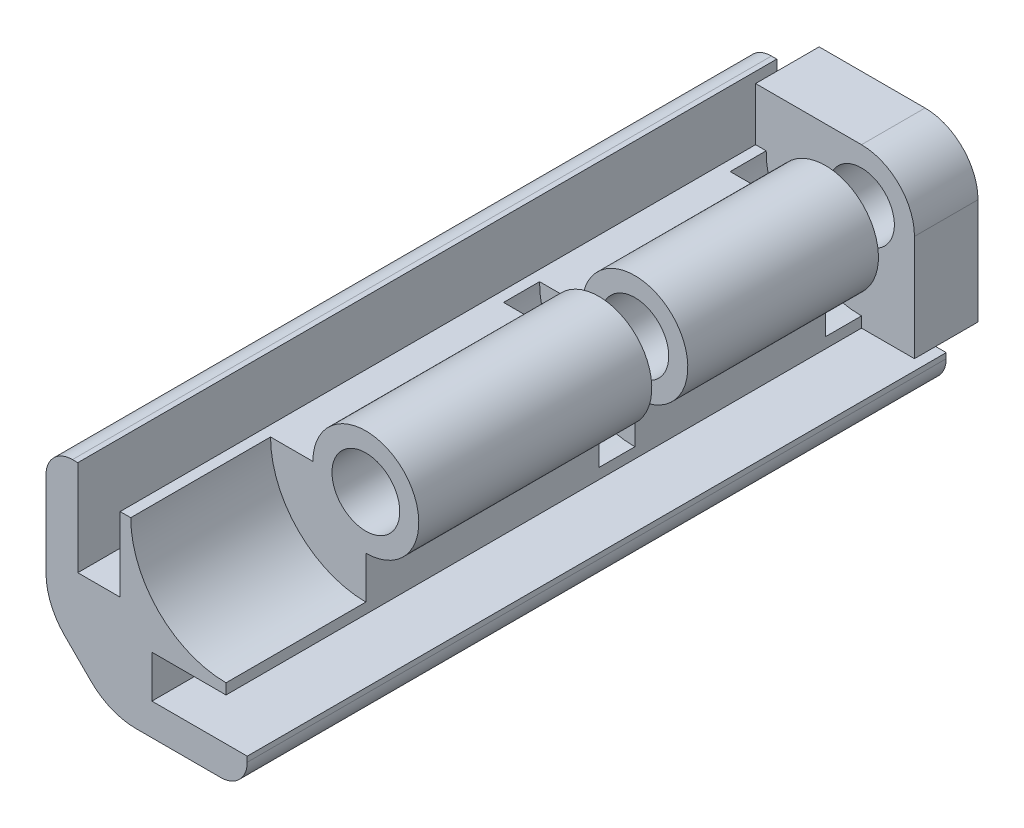
from build123d import *

# Parameters (mm, degrees)
SKETCH1_R              = 1.55
BOSS_EXTRUDE1_DEPTH    = 33
CUT_EXTRUDE2_START     = 3
CUT_EXTRUDE2_OUTLINE_R = 1.55
CUT_EXTRUDE2_DEPTH     = 30
BOSS_EXTRUDE3_START    = 15.4
SKETCH7_R              = 1.6
BOSS_EXTRUDE3_DEPTH    = 11
SKETCH14_R             = 1.6
BOSS_EXTRUDE4_DEPTH    = 9


# Read off the part's stored shape, not the designer's step: Cut-Extrude2
with BuildPart() as part:
    # Sketch1 → Boss-Extrude1 (new body)
    with BuildSketch(Plane.XY):
        with BuildLine():
            Line((9.5, 1.5), (9.5, 1.25))
            ThreePointArc((9.5, 1.25), (9.133883476, 0.366116524), (8.25, 0))
            Line((8.25, 0), (4.242640687, 0))
            ThreePointArc((4.242640687, 0), (3.09459039, 0.228361402), (2.121320344, 0.878679656))
            Line((2.121320344, 0.878679656), (0.878679656, 2.121320344))
            ThreePointArc((0.878679656, 2.121320344), (0.228361402, 3.09459039), (0, 4.242640687))
            Line((0, 4.242640687), (0, 8.25))
            ThreePointArc((0, 8.25), (0.366116524, 9.133883476), (1.25, 9.5))
            Line((1.25, 9.5), (1.5, 9.5))
            Line((1.5, 9.5), (1.5, 5))
            Line((1.5, 5), (3.5, 5))
            Line((3.5, 5), (3.5, 11))
            Line((3.5, 11), (8.5, 11))
            ThreePointArc((8.5, 11), (10.267766953, 10.267766953), (11, 8.5))
            Line((11, 8.5), (11, 3.5))
            Line((11, 3.5), (5, 3.5))
            Line((5, 3.5), (5, 1.5))
            Line((5, 1.5), (9.5, 1.5))
        make_face()
        with Locations((8.5, 8.5)):
            Circle(SKETCH1_R, mode=Mode.SUBTRACT)
    extrude(amount=BOSS_EXTRUDE1_DEPTH)

    # Cut-Extrude2 outline → Cut-Extrude2 (cut)
    with BuildSketch(Plane.XY.offset(CUT_EXTRUDE2_START)):
        with BuildLine():
            Line((3.5, 8.5), (4, 8.5))
            ThreePointArc((4, 8.5), (5.318019485, 5.318019485), (8.5, 4))
            Line((8.5, 4), (8.5, 3.5))
            Line((8.5, 3.5), (11, 3.5))
            Line((11, 3.5), (11, 8.5))
            ThreePointArc((11, 8.5), (10.267766953, 10.267766953), (8.5, 11))
            Line((8.5, 11), (3.5, 11))
            Line((3.5, 11), (3.5, 8.5))
        make_face()
        with Locations((8.5, 8.5)):
            Circle(CUT_EXTRUDE2_OUTLINE_R, mode=Mode.SUBTRACT)
    extrude(amount=CUT_EXTRUDE2_DEPTH, mode=Mode.SUBTRACT)

    # Sketch7 → Boss-Extrude3 (add)
    with BuildSketch(Plane.XY.offset(BOSS_EXTRUDE3_START)):
        with BuildLine():
            Line((8.5, 6), (8.5, 4))
            ThreePointArc((8.5, 4), (5.318019485, 5.318019485), (4, 8.5))
            Line((4, 8.5), (6, 8.5))
            ThreePointArc((6, 8.5), (10.267766953, 10.267766953), (8.5, 6))
        make_face()
        with Locations((8.5, 8.5)):
            Circle(SKETCH7_R, mode=Mode.SUBTRACT)
    extrude(amount=BOSS_EXTRUDE3_DEPTH)

    # Sketch14 → Boss-Extrude4 (add)
    with BuildSketch(Plane.XY.offset(4.7)):
        with BuildLine():
            Line((6, 8.5), (4, 8.5))
            ThreePointArc((4, 8.5), (5.318019485, 5.318019485), (8.5, 4))
            Line((8.5, 4), (8.5, 6))
            ThreePointArc((8.5, 6), (10.267766953, 10.267766953), (6, 8.5))
        make_face()
        with Locations((8.5, 8.5)):
            Circle(SKETCH14_R, mode=Mode.SUBTRACT)
    extrude(amount=BOSS_EXTRUDE4_DEPTH)


solid = part.part
